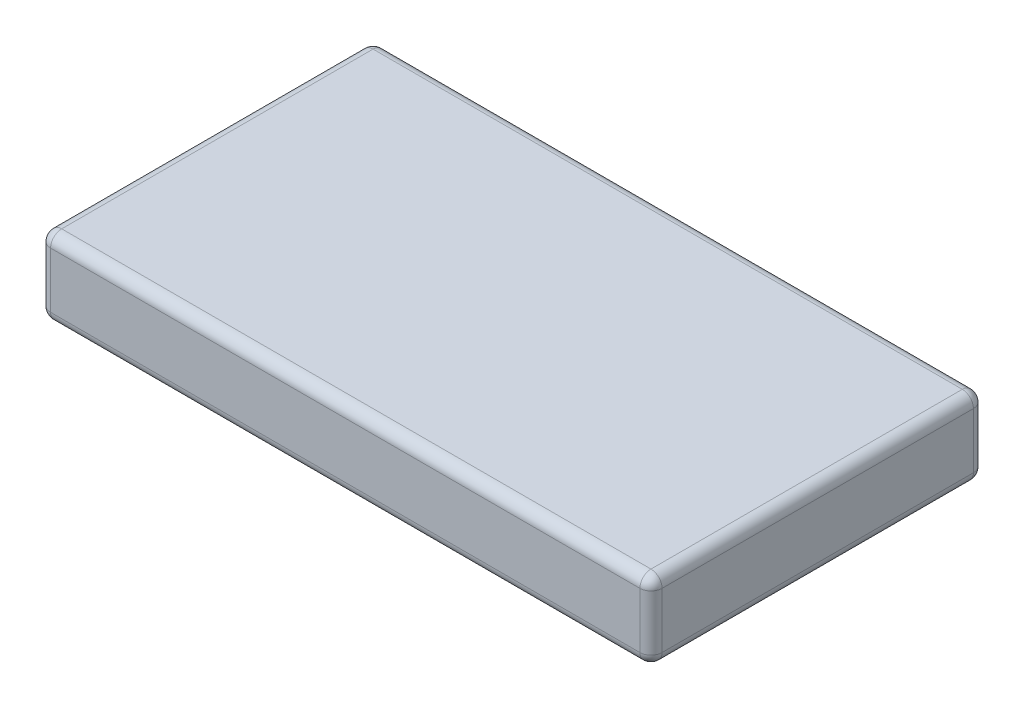
from build123d import *

# Parameters (mm, degrees)
SKETCH1_W           = 55
SKETCH1_H           = 30
BOSS_EXTRUDE1_DEPTH = 7
FILLET1_R           = 1


with BuildPart() as part:
    # Sketch1 → Boss-Extrude1 (new body)
    with BuildSketch(Plane(origin=(0, 0, 0), x_dir=(1, 0, 0), z_dir=(0, 1, 0))):
        Rectangle(SKETCH1_W, SKETCH1_H)
    extrude(amount=BOSS_EXTRUDE1_DEPTH)

    # Fillet1
    fillet1_edges = [part.edges().sort_by_distance(p)[0] for p in [
        (-27.5, 3.5, -15),
        (27.5, 3.5, -15),
        (-27.5, 7, 0),
        (0, 7, -15),
        (27.5, 7, 0),
        (-27.5, 3.5, 15),
        (0, 7, 15),
        (27.5, 3.5, 15),
        (0, 0, -15),
        (-27.5, 0, 0),
        (0, 0, 15),
        (27.5, 0, 0),
    ]]
    fillet(fillet1_edges, radius=FILLET1_R)


solid = part.part
